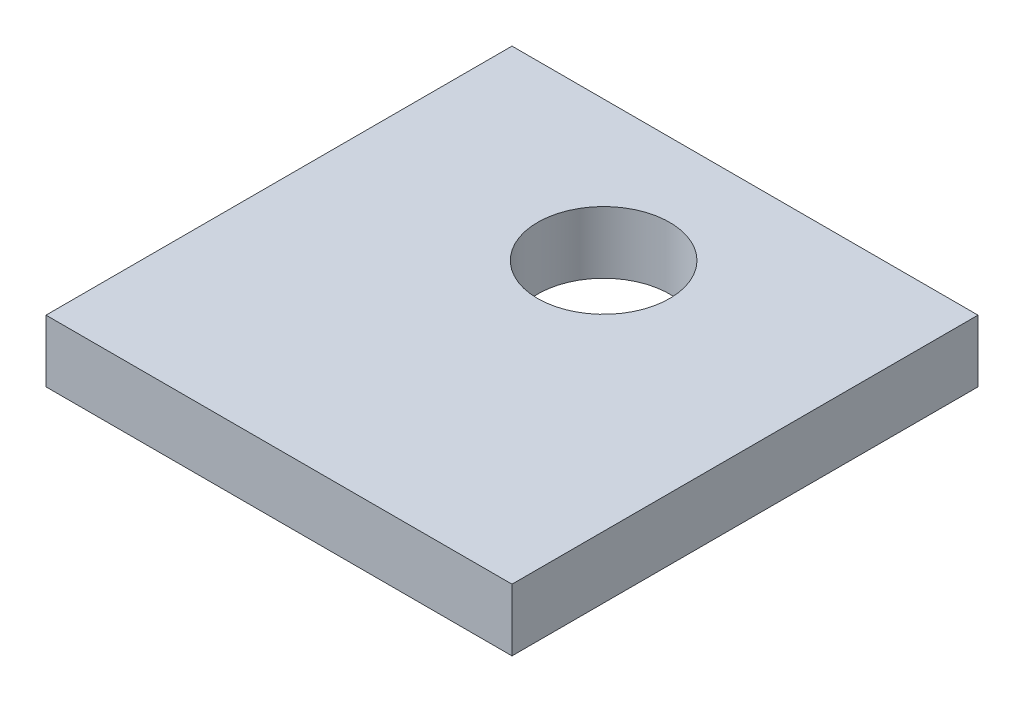
from build123d import *

# Parameters (mm, degrees)
SKETCH1_W           = 30
SKETCH1_H           = 30
BOSS_EXTRUDE1_DEPTH = 2
SKETCH2_R           = 4.25
CUT_EXTRUDE1_DEPTH  = 22.587033145


with BuildPart() as part:
    # Sketch1 → Boss-Extrude1 (new, symmetric)
    with BuildSketch(Plane(origin=(0, 0, 0), x_dir=(1, 0, 0), z_dir=(0, 1, 0))):
        Rectangle(SKETCH1_W, SKETCH1_H)
    extrude(amount=BOSS_EXTRUDE1_DEPTH, both=True)

    # Sketch2 → Cut-Extrude1 (cut, through all)
    with BuildSketch(Plane(origin=(0, 2, 0), x_dir=(1, 0, 0), z_dir=(0, 1, 0))):
        with Locations((-0.1, 6)):
            Circle(SKETCH2_R)
    extrude(amount=-CUT_EXTRUDE1_DEPTH, mode=Mode.SUBTRACT)


solid = part.part
